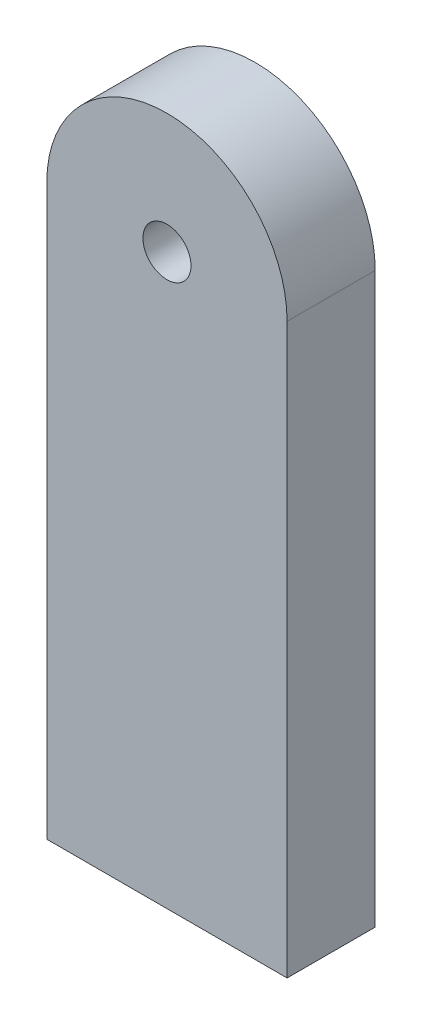
from build123d import *

# Parameters (mm, degrees)
BOSS_EXTRUDE1_DEPTH = 2.5
SKETCH3_R           = 1.5
BOSS_EXTRUDE2_DEPTH = 3


with BuildPart() as part:
    # Sketch1 → Boss-Extrude1 (new body)
    with BuildSketch(Plane.XY):
        with BuildLine():
            ThreePointArc((7.457118183, 0.082245335), (-0.042881817, 7.582245335), (-7.542881817, 0.082245335))
            Line((-7.542881817, 0.082245335), (-7.542881817, -35.417754665))
            Line((-7.542881817, -35.417754665), (7.457118183, -35.417754665))
            Line((7.457118183, -35.417754665), (7.457118183, 0.082245335))
        make_face()
        Polygon((1.632118183, 2.983430437), (3.307118183, 0.082245335), (1.632118183, -2.818939768), (-0.042881817, -2.818939768), (-1.717881817, -2.818939768), (-3.392881817, 0.082245335), (-1.717881817, 2.983430437), (-0.042881817, 2.983430437), align=None, mode=Mode.SUBTRACT)
    extrude(amount=BOSS_EXTRUDE1_DEPTH)

    # Sketch3 → Boss-Extrude2 (add)
    with BuildSketch(Plane.XY.offset(2.5)):
        with BuildLine():
            Line((7.457118183, 0.082245335), (7.457118183, -35.417754665))
            Line((7.457118183, -35.417754665), (-7.542881817, -35.417754665))
            Line((-7.542881817, -35.417754665), (-7.542881817, 0.082245335))
            ThreePointArc((-7.542881817, 0.082245335), (-0.042881817, 7.582245335), (7.457118183, 0.082245335))
        make_face()
        with Locations((-0.042881817, 0.082245335)):
            Circle(SKETCH3_R, mode=Mode.SUBTRACT)
    extrude(amount=BOSS_EXTRUDE2_DEPTH)


solid = part.part
